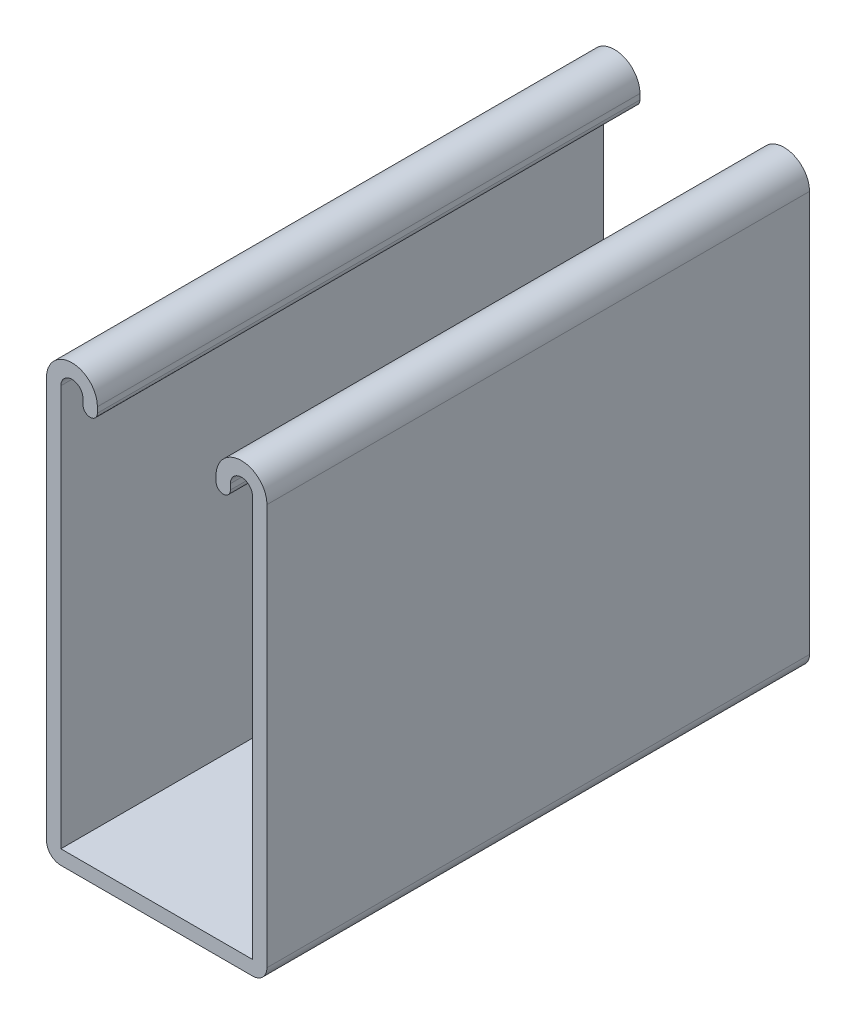
from build123d import *

# Parameters (mm, degrees)
BASE_EXTRUDE_DEPTH = 101.6
HOLE1_START        = -38.1
HOLE1_OUTLINE_R    = 7.14375
HOLE1_DEPTH        = 2.6924
LPATTERN2_COUNT    = 2
LPATTERN2_PITCH    = 47.625


# Read off the part's stored shape, not the designer's step: Hole1
with BuildPart() as part:
    # Sketch1 → Base-Extrude (new body)
    with BuildSketch(Plane.XY):
        with BuildLine():
            Line((-20.6375, 39.6875), (-20.6375, -35.4076))
            ThreePointArc((-20.6375, -35.4076), (-19.848914298, -37.311414298), (-17.9451, -38.1))
            Line((-17.9451, -38.1), (17.9451, -38.1))
            ThreePointArc((17.9451, -38.1), (19.848914298, -37.311414298), (20.6375, -35.4076))
            Line((20.6375, -35.4076), (20.6375, 39.6875))
            ThreePointArc((20.6375, 39.6875), (15.875, 44.45), (11.1125, 39.6875))
            Line((11.1125, 39.6875), (11.1125, 38.65245))
            ThreePointArc((11.1125, 38.65245), (12.4587, 37.30625), (13.8049, 38.65245))
            Line((13.8049, 38.65245), (13.8049, 39.6875))
            ThreePointArc((13.8049, 39.6875), (15.875, 41.7576), (17.9451, 39.6875))
            Line((17.9451, 39.6875), (17.9451, -35.4076))
            Line((17.9451, -35.4076), (-17.9451, -35.4076))
            Line((-17.9451, -35.4076), (-17.9451, 39.6875))
            ThreePointArc((-17.9451, 39.6875), (-15.875, 41.7576), (-13.8049, 39.6875))
            Line((-13.8049, 39.6875), (-13.8049, 38.65245))
            ThreePointArc((-13.8049, 38.65245), (-12.4587, 37.30625), (-11.1125, 38.65245))
            Line((-11.1125, 38.65245), (-11.1125, 39.6875))
            ThreePointArc((-11.1125, 39.6875), (-15.875, 44.45), (-20.6375, 39.6875))
        make_face()
    extrude(amount=BASE_EXTRUDE_DEPTH)

    # Hole1 outline → Hole1 (cut)
    with BuildSketch(Plane(origin=(0, 0, 0), x_dir=(1, 0, 0), z_dir=(0, 1, 0)).offset(HOLE1_START)):
        with Locations((0, -23.8125)):
            Circle(HOLE1_OUTLINE_R)
    hole1 = extrude(amount=HOLE1_DEPTH, mode=Mode.SUBTRACT)

    # LPattern2: Hole1 ×2
    with Locations(*[(0, 0, i * LPATTERN2_PITCH) for i in range(1, LPATTERN2_COUNT)]):
        add(hole1, mode=Mode.SUBTRACT)


solid = part.part
